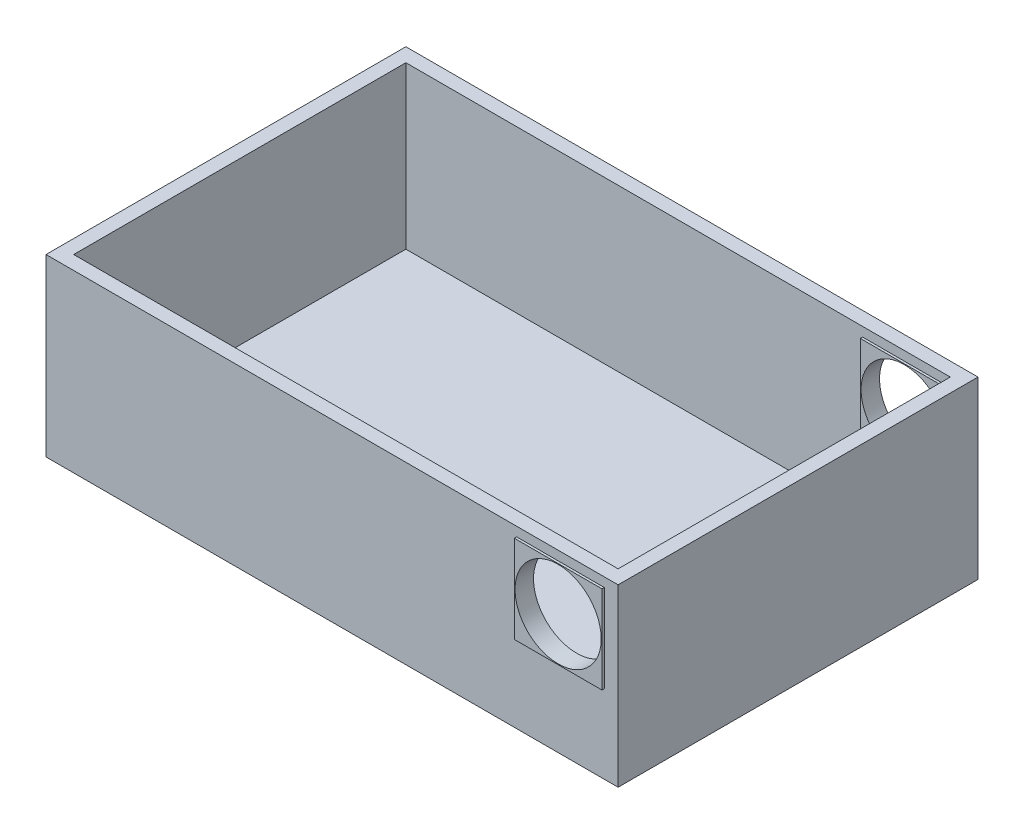
from build123d import *

# Parameters (mm, degrees)
SKETCH1_W           = 787.4
SKETCH1_H           = 495.3
BOSS_EXTRUDE1_DEPTH = 241.3
SHELL1_T            = -19.05
BOSS_EXTRUDE2_START = -22.225
SKETCH2_W           = 120.65
SKETCH2_H           = 120.65
BOSS_EXTRUDE2_DEPTH = 25.4
SKETCH3_R           = 59.309
CUT_EXTRUDE2_DEPTH  = 25.4


with BuildPart() as part:
    # Sketch1 → Boss-Extrude1 (new body)
    with BuildSketch(Plane(origin=(0, 0, 0), x_dir=(1, 0, 0), z_dir=(0, 1, 0))):
        with Locations((393.7, 247.65)):
            Rectangle(SKETCH1_W, SKETCH1_H)
    extrude(amount=BOSS_EXTRUDE1_DEPTH)

    # Shell1
    shell1_openings = [part.faces().sort_by_distance(p)[0] for p in [
        (393.7, 241.3, -247.65),
    ]]
    offset(amount=SHELL1_T, openings=shell1_openings, kind=Kind.INTERSECTION)

    # Sketch2 → Boss-Extrude2 (add)
    with BuildSketch(Plane.XY.offset(BOSS_EXTRUDE2_START)):
        with Locations((708.025, 168.275)):
            Rectangle(SKETCH2_W, SKETCH2_H)
    boss_extrude2 = extrude(amount=BOSS_EXTRUDE2_DEPTH)

    # Sketch3 → Cut-Extrude2 (cut)
    with BuildSketch(Plane.XY.offset(3.175)):
        with Locations((708.025, 168.275)):
            Circle(SKETCH3_R)
    cut_extrude2 = extrude(amount=-CUT_EXTRUDE2_DEPTH, mode=Mode.SUBTRACT)

    # Mirror1: Boss-Extrude2, Cut-Extrude2 across plane
    add(boss_extrude2.mirror(Plane.XY.offset(-247.65)))
    add(cut_extrude2.mirror(Plane.XY.offset(-247.65)), mode=Mode.SUBTRACT)


solid = part.part
